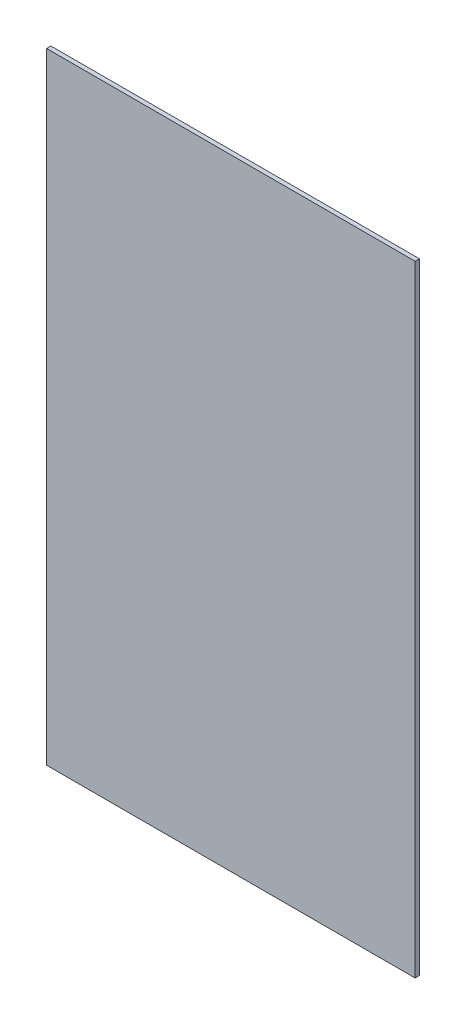
from build123d import *

# Parameters (mm, degrees)
SKETCH_1_W      = 518
SKETCH_1_H      = 872.6
EXTRUDE_1_DEPTH = 6


with BuildPart() as part:
    # Эскиз1 → Бобышка-Вытянуть1 (new body)
    with BuildSketch(Plane.XY):
        with Locations((-259, 0)):
            Rectangle(SKETCH_1_W, SKETCH_1_H)
    extrude(amount=-EXTRUDE_1_DEPTH)


solid = part.part
